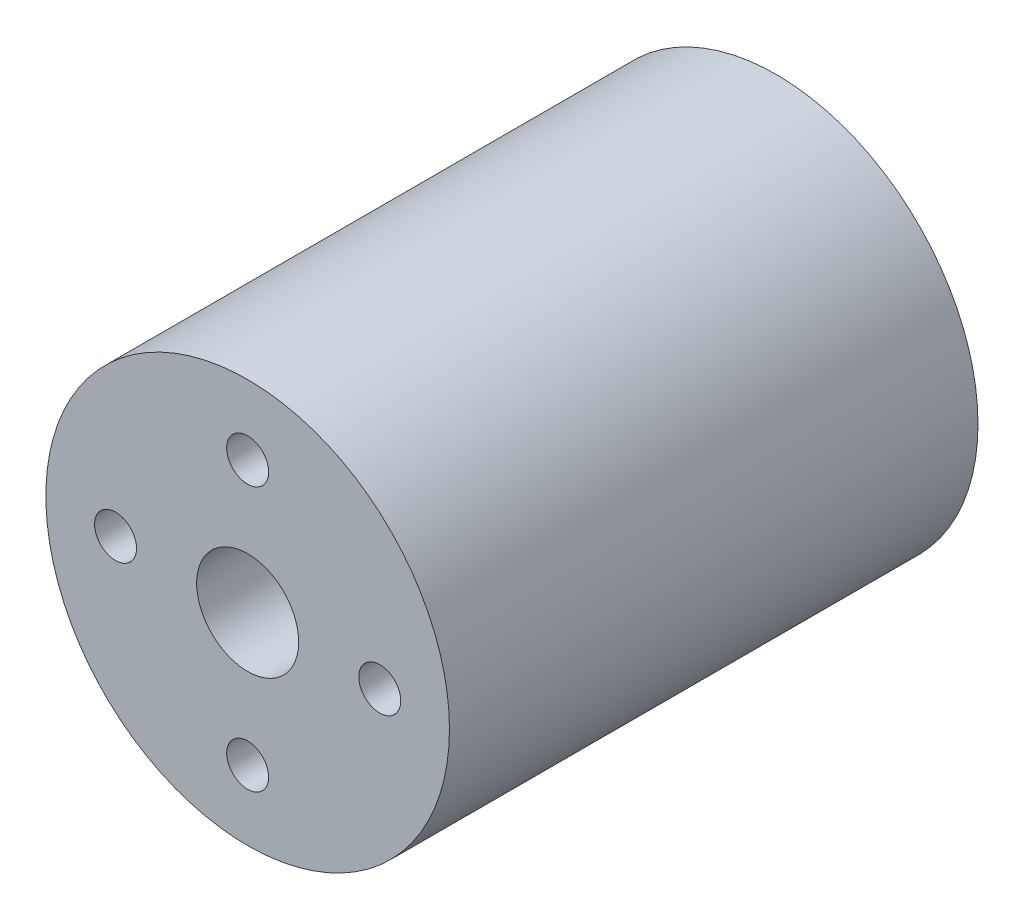
from build123d import *

# Parameters (mm, degrees)
SKETCH1_R           = 11.455
BOSS_EXTRUDE1_DEPTH = 30
SKETCH1_3_R         = 1.190625
CUT_EXTRUDE1_DEPTH  = 8
SKETCH1_4_R         = 2.8956
CUT_EXTRUDE2_DEPTH  = 16


with BuildPart() as part:
    # Sketch1 → Boss-Extrude1 (new body)
    with BuildSketch(Plane(origin=(0, 0, 0), x_dir=(0, 1, 0), z_dir=(0, 0, 1))):
        Circle(SKETCH1_R)
    extrude(amount=-BOSS_EXTRUDE1_DEPTH)

    # Sketch1<3> → Cut-Extrude1 (cut)
    with BuildSketch(Plane(origin=(0, 0, 0), x_dir=(0, 1, 0), z_dir=(0, 0, 1))):
        with Locations((0, 7.5)):
            Circle(SKETCH1_3_R)
        with Locations((-7.5, 0)):
            Circle(SKETCH1_3_R)
        with Locations((7.5, 0)):
            Circle(SKETCH1_3_R)
        with Locations((0, -7.5)):
            Circle(SKETCH1_3_R)
    extrude(amount=-CUT_EXTRUDE1_DEPTH, mode=Mode.SUBTRACT)

    # Sketch1<4> → Cut-Extrude2 (cut)
    with BuildSketch(Plane(origin=(0, 0, 0), x_dir=(0, 1, 0), z_dir=(0, 0, 1))):
        Circle(SKETCH1_4_R)
    extrude(amount=-CUT_EXTRUDE2_DEPTH, mode=Mode.SUBTRACT)


solid = part.part
